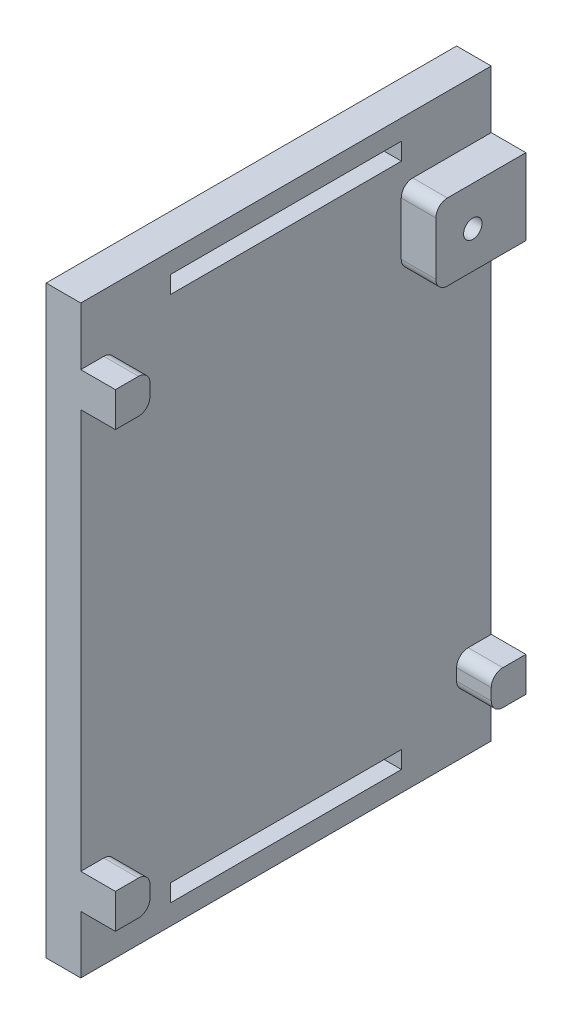
from build123d import *

# Parameters (mm, degrees)
SKETCH1_W               = 50.64
SKETCH1_H               = 35.56
BOSS_EXTRUDE1_DEPTH     = 3
CUT_EXTRUDE1_DEPTH      = 32.084253248
CUT_EXTRUDE1_DEPTH_BACK = 32.084253248
SKETCH2_W               = 1.5
SKETCH2_H               = 20
SKETCH3_W               = 3
SKETCH3_H               = 3
SKETCH3_W_2             = 6.604
SKETCH3_H_2             = 7.797
SKETCH3_R               = 0.8
BOSS_EXTRUDE2_DEPTH     = 3
CUT_EXTRUDE2_DEPTH      = 32.515564409
CUT_EXTRUDE2_DEPTH_BACK = 32.515564409
SKETCH4_R               = 0.8
FILLET1_R               = 1


with BuildPart() as part:
    # Sketch1 → Boss-Extrude1 (new body)
    with BuildSketch(Plane.YZ):
        Rectangle(SKETCH1_W, SKETCH1_H)
    extrude(amount=BOSS_EXTRUDE1_DEPTH)

    # Sketch2 → Cut-Extrude1 (cut, two sides: drawn at the far end of the back side and taken through both)
    with BuildSketch(Plane.YZ.offset(3).offset(-CUT_EXTRUDE1_DEPTH_BACK)):
        with Locations((-22.82, 0)):
            Rectangle(SKETCH2_W, SKETCH2_H)
        with Locations((22.82, 0)):
            Rectangle(SKETCH2_W, SKETCH2_H)
    extrude(amount=CUT_EXTRUDE1_DEPTH + CUT_EXTRUDE1_DEPTH_BACK, mode=Mode.SUBTRACT)

    # Sketch3 → Boss-Extrude2 (add)
    # profile 1 of 4: a face of its own
    with BuildSketch(Plane.YZ.offset(3)):
        with Locations((-18.82, 16.28)):
            Rectangle(SKETCH3_W, SKETCH3_H)
    # profile 2 of 4: a face of its own
    with BuildSketch(Plane.YZ.offset(3)):
        with Locations((-18.82, -16.28)):
            Rectangle(SKETCH3_W, SKETCH3_H)
    # profile 3 of 4: a face of its own
    with BuildSketch(Plane.YZ.offset(3)):
        with Locations((18.82, 16.28)):
            Rectangle(SKETCH3_W, SKETCH3_H)
    # profile 4 of 4: a face of its own
    with BuildSketch(Plane.YZ.offset(3)):
        with Locations((17.018, -13.8815)):
            Rectangle(SKETCH3_W_2, SKETCH3_H_2)
        with Locations((16.916, -13.183)):
            Circle(SKETCH3_R, mode=Mode.SUBTRACT)
    extrude(amount=BOSS_EXTRUDE2_DEPTH)

    # Sketch4 → Cut-Extrude2 (cut, two sides: drawn at the far end of the back side and taken through both)
    with BuildSketch(Plane.YZ.offset(6).offset(-CUT_EXTRUDE2_DEPTH_BACK)):
        with Locations((16.916, -13.183)):
            Circle(SKETCH4_R)
    extrude(amount=CUT_EXTRUDE2_DEPTH + CUT_EXTRUDE2_DEPTH_BACK, mode=Mode.SUBTRACT)

    # Fillet1
    fillet1_edges = [part.edges().sort_by_distance(p)[0] for p in [
        (4.5, -17.32, -14.78),
        (4.5, -20.32, -14.78),
        (4.5, 13.716, -9.983),
        (4.5, 20.32, -9.983),
        (4.5, 20.32, 14.78),
        (4.5, 17.32, 14.78),
        (4.5, -20.32, 14.78),
        (4.5, -17.32, 14.78),
    ]]
    fillet(fillet1_edges, radius=FILLET1_R)


solid = part.part
